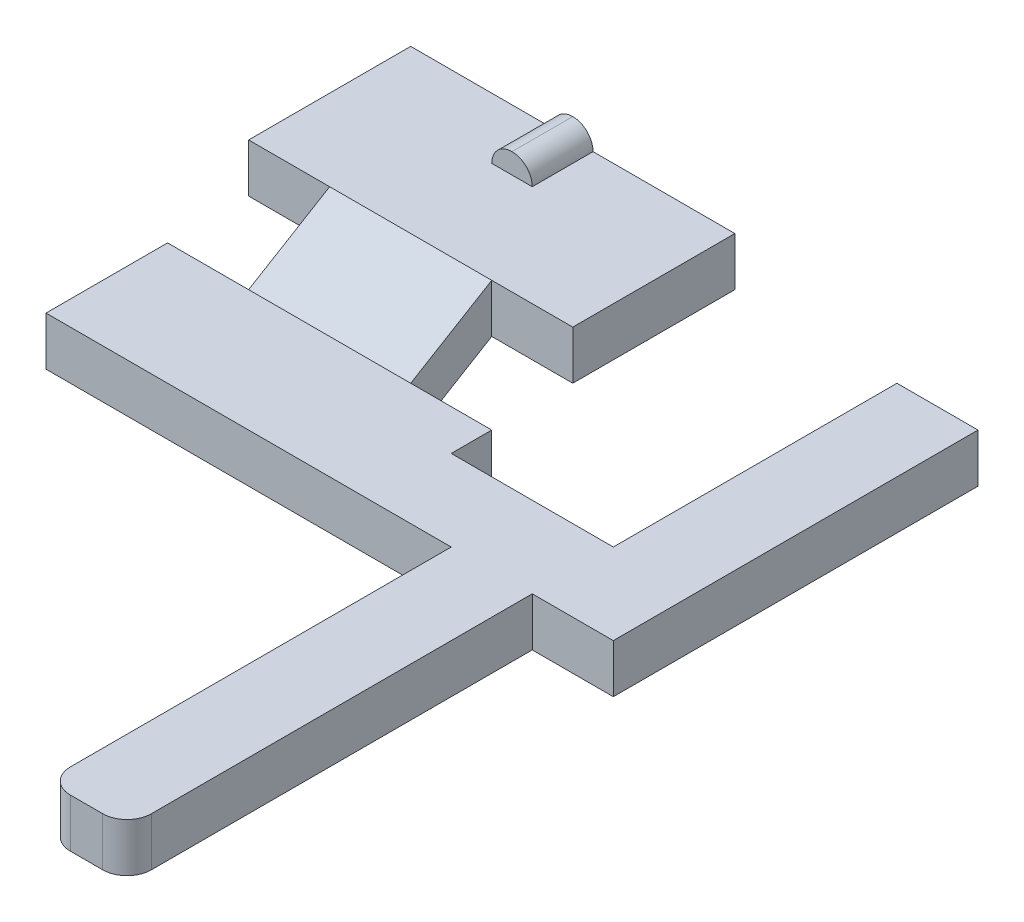
from build123d import *

# Parameters (mm, degrees)
BOSS_EXTRUDE1_DEPTH = 0.6
SKETCH2_W           = 4
SKETCH2_H           = 2
BOSS_EXTRUDE2_DEPTH = 0.6
FILLET1_R           = 0.3
SKETCH5_W           = 0.5
SKETCH5_H           = 0.75
BOSS_EXTRUDE3_DEPTH = 0.25
FILLET2_R           = 0.25


with BuildPart() as part:
    # Sketch1 → Boss-Extrude1 (new body)
    with BuildSketch(Plane(origin=(0, 0, 0), x_dir=(1, 0, 0), z_dir=(0, 1, 0))):
        Polygon((0, 0), (0, 5), (1, 5), (1, 9.5), (0, 9.5), (0, 6), (-2, 6), (-2, 6.5), (-6, 6.5), (-6, 5), (-1, 5), (-1, 0), align=None)
    extrude(amount=BOSS_EXTRUDE1_DEPTH)



with BuildPart() as body_2:
    # Sketch2 → Boss-Extrude2 (new body)
    with BuildSketch(Plane(origin=(0, 0.6, 0), x_dir=(1, 0, 0), z_dir=(0, 1, 0))):
        with Locations((-4, 8.5)):
            Rectangle(SKETCH2_W, SKETCH2_H)
    extrude(amount=BOSS_EXTRUDE2_DEPTH)


with BuildPart() as part_1:
    add(part.part)

    add(body_2.part)  # Loft1 merges body 2
    # Sketch3 → Loft1 section 0
    with BuildSketch(Plane.XY.offset(-7.5)):
        with BuildLine():
            Line((-3, 1.2), (-5, 1.2))
            Line((-5, 1.2), (-5, 0.6))
            Line((-5, 0.6), (-3, 0.6))
            Line((-3, 0.6), (-3, 1.2))
        make_face()
    # Sketch4 → Loft1 section 1
    with BuildSketch(Plane(origin=(0, 0, -6.5), x_dir=(-1, 0, 0), z_dir=(0, 0, -1))):
        with BuildLine():
            Line((3, 0.6), (5, 0.6))
            Line((5, 0.6), (5, 0))
            Line((5, 0), (3, 0))
            Line((3, 0), (3, 0.6))
        make_face()
    loft()

    # Fillet1
    fillet1_edges = [part_1.edges().sort_by_distance(p)[0] for p in [
        (-1, 0.3, 0),
        (0, 0.3, 0),
    ]]
    fillet(fillet1_edges, radius=FILLET1_R)

    # Sketch5 → Boss-Extrude3 (add)
    with BuildSketch(Plane(origin=(0, 1.2, 0), x_dir=(1, 0, 0), z_dir=(0, 1, 0))):
        with Locations((-4, 9.125)):
            Rectangle(SKETCH5_W, SKETCH5_H)
    extrude(amount=BOSS_EXTRUDE3_DEPTH)

    # Fillet2
    fillet2_edges = [part_1.edges().sort_by_distance(p)[0] for p in [
        (-3.75, 1.45, -9.125),
        (-4.25, 1.45, -9.125),
    ]]
    fillet(fillet2_edges, radius=FILLET2_R - 0.0001)  # a hair under: the kernel refuses the full size


solid = part_1.part
